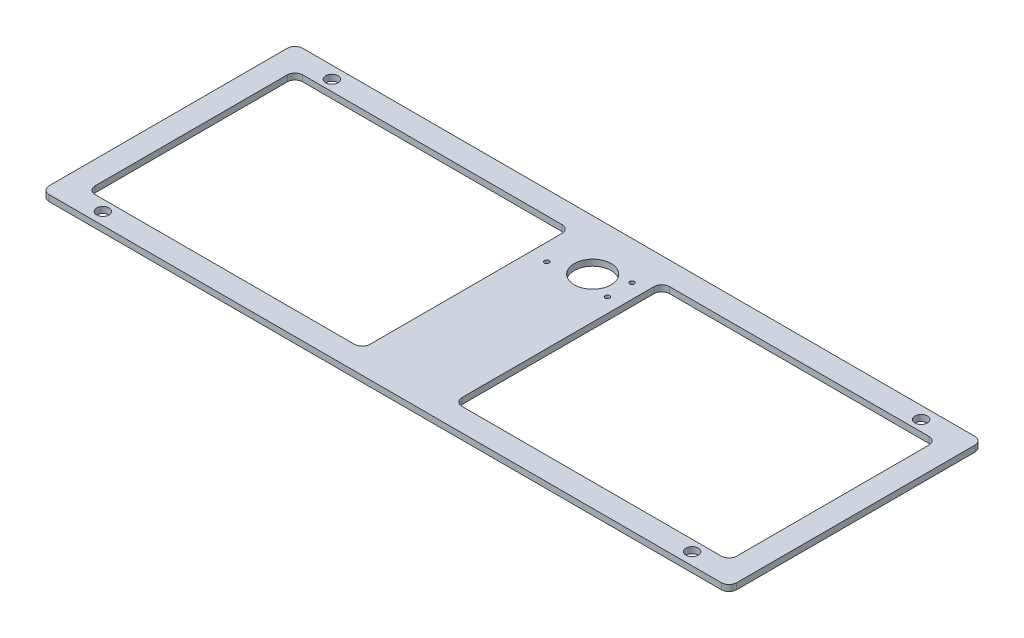
from build123d import *

# Parameters (mm, degrees)
SKETCH1_W             = 200
SKETCH1_H             = 82.6
BASE_FLANGE1_DEPTH    = 2
SKETCH6_R             = 2
CUT_EXTRUDE1_DEPTH    = 148.587569056
SKETCH7_W             = 77.5
SKETCH7_H             = 67.6
CUT_EXTRUDE2_DEPTH    = 148.587569056
SKETCH8_W             = 82.6
SKETCH8_H             = 2
BOSS_EXTRUDE1_DEPTH   = 12
SKETCH9_W             = 82.6
SKETCH9_H             = 2
BOSS_EXTRUDE2_DEPTH   = 12
SKETCH10_W            = 12
SKETCH10_H            = 67.6
CUT_EXTRUDE3_DEPTH    = 159.943577694
FILLET1_R             = 2.5
SKETCH11_R            = 6
CUT_EXTRUDE4_DEPTH    = 159.943577694
F_1_5MM_DOWEL_HOLE1_D = 1.5


# Sheet-metal steps are written as plain solids
with BuildPart() as part:
    # Sketch1 → Base-Flange1 (new body)
    with BuildSketch(Plane(origin=(0, 0, 0), x_dir=(1, 0, 0), z_dir=(0, 1, 0))):
        with Locations((39.040431267, 8.155525606)):
            Rectangle(SKETCH1_W, SKETCH1_H)
    extrude(amount=-BASE_FLANGE1_DEPTH)

    # Sketch6 → Cut-Extrude1 (cut, through all)
    with BuildSketch(Plane(origin=(0, 0, 0), x_dir=(1, 0, 0), z_dir=(0, 1, 0))):
        with Locations(Location((-56.959568733, 45.455525606, 0), (0, 0, 270))):
            Circle(SKETCH6_R)
        with Locations(Location((-56.959568733, -29.144474394, 0), (0, 0, 270))):
            Circle(SKETCH6_R)
        with Locations(Location((135.040431267, -29.144474394, 0), (0, 0, 270))):
            Circle(SKETCH6_R)
        with Locations(Location((135.040431267, 45.455525606, 0), (0, 0, 270))):
            Circle(SKETCH6_R)
    extrude(amount=-CUT_EXTRUDE1_DEPTH, mode=Mode.SUBTRACT)

    # Sketch7 → Cut-Extrude2 (cut, through all)
    with BuildSketch(Plane(origin=(0, 0, 0), x_dir=(1, 0, 0), z_dir=(0, 1, 0))):
        with Locations((-14.709568733, 8.155525606)):
            Rectangle(SKETCH7_W, SKETCH7_H)
        with Locations((92.790431267, 8.155525606)):
            Rectangle(SKETCH7_W, SKETCH7_H)
    extrude(amount=-CUT_EXTRUDE2_DEPTH, mode=Mode.SUBTRACT)

    # Sketch8 → Boss-Extrude1 (add)
    with BuildSketch(Plane.ZY.offset(60.959568733)):
        with Locations((-8.155525606, -1)):
            Rectangle(SKETCH8_W, SKETCH8_H)
    extrude(amount=BOSS_EXTRUDE1_DEPTH)

    # Sketch9 → Boss-Extrude2 (add)
    with BuildSketch(Plane(origin=(139.040431267, 0, 0), x_dir=(0, 0, -1), z_dir=(1, 0, 0))):
        with Locations((8.155525606, -1)):
            Rectangle(SKETCH9_W, SKETCH9_H)
    extrude(amount=BOSS_EXTRUDE2_DEPTH)

    # Sketch10 → Cut-Extrude3 (cut, through all)
    with BuildSketch(Plane(origin=(0, 0, 0), x_dir=(1, 0, 0), z_dir=(0, 1, 0))):
        with Locations((-59.459568733, 8.155525606)):
            Rectangle(SKETCH10_W, SKETCH10_H)
        with Locations((137.540431267, 8.155525606)):
            Rectangle(SKETCH10_W, SKETCH10_H)
    extrude(amount=-CUT_EXTRUDE3_DEPTH, mode=Mode.SUBTRACT)

    # Fillet1
    fillet1_edges = [part.edges().sort_by_distance(p)[0] for p in [
        (-65.459568733, -1, 25.644474394),
        (-65.459568733, -1, -41.955525606),
        (143.540431267, -1, -41.955525606),
        (143.540431267, -1, 25.644474394),
        (24.040431267, -1, -41.955525606),
        (24.040431267, -1, 25.644474394),
        (54.040431267, -1, 25.644474394),
        (54.040431267, -1, -41.955525606),
        (-72.959568733, -1, -49.455525606),
        (-72.959568733, -1, 33.144474394),
        (151.040431267, -1, -49.455525606),
        (151.040431267, -1, 33.144474394),
    ]]
    fillet(fillet1_edges, radius=FILLET1_R)

    # Sketch11 → Cut-Extrude4 (cut, through all)
    with BuildSketch(Plane(origin=(0, 0, 0), x_dir=(1, 0, 0), z_dir=(0, 1, 0))):
        with Locations(Location((40.540479107, 32.955525606, 0), (0, 0, 270))):
            Circle(SKETCH11_R)
    extrude(amount=-CUT_EXTRUDE4_DEPTH, mode=Mode.SUBTRACT)

    # Ø1.5mm Dowel Hole1 (through all)
    with Locations(Plane(origin=(0, 0, 0), x_dir=(1, 0, 0), z_dir=(0, 1, 0))):
        with Locations((49.340479107, 36.955525606), (49.340479107, 28.955525606), (29.540479107, 28.955525606)):
            Hole(F_1_5MM_DOWEL_HOLE1_D / 2)


solid = part.part
